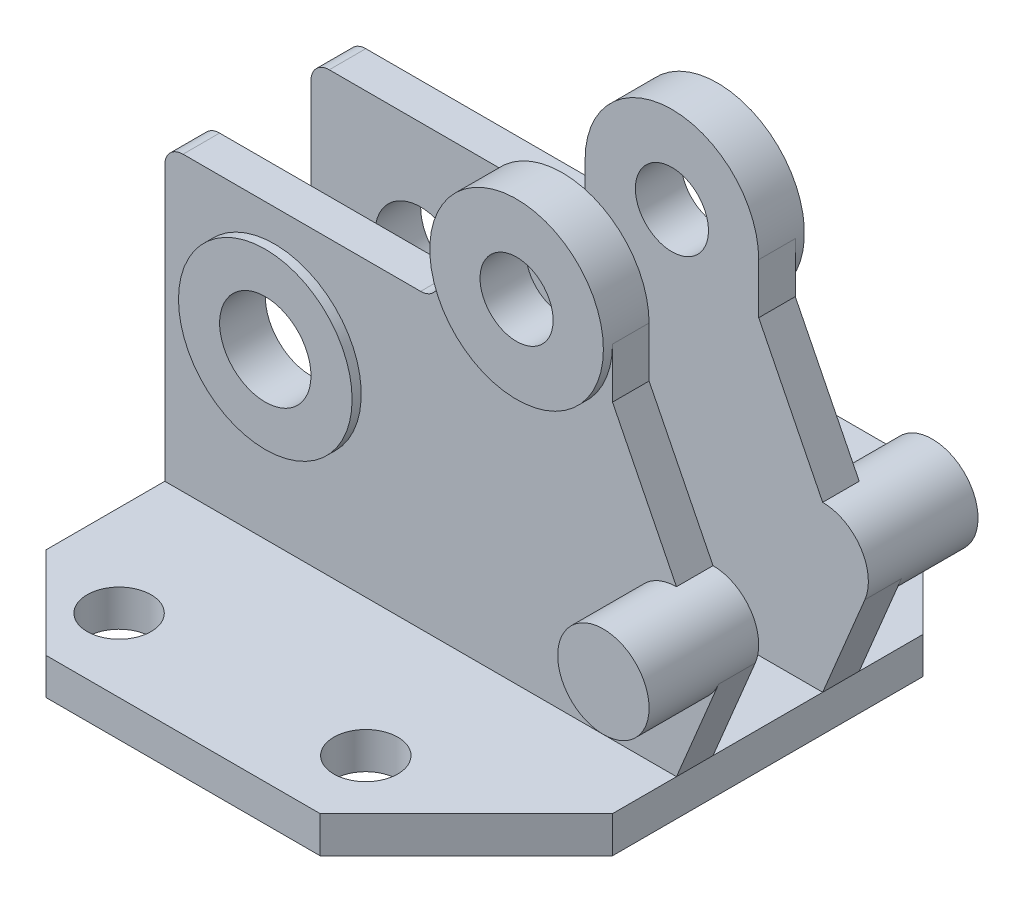
from build123d import *
from build123d.topology import SkipClean

# Parameters (mm, degrees)
SKETCH1_R               = 3.5
SKETCH1_W               = 56
SKETCH1_H               = 4
SKETCH1_H_2             = 12
BOSS_EXTRUDE1_DEPTH     = 4
SKETCH1_3_W             = 56
SKETCH1_3_H             = 4
BOSS_EXTRUDE2_DEPTH     = 36
SKETCH2_R               = 5
CUT_EXTRUDE1_DEPTH      = 36
BOSS_EXTRUDE3_START     = -20
BOSS_EXTRUDE3_OUTLINE_R = 9.5
BOSS_EXTRUDE3_DEPTH     = 20
CUT_EXTRUDE2_START      = -21
SKETCH2_4_R             = 4
CUT_EXTRUDE2_DEPTH      = 21
SKETCH4_W               = 61
SKETCH4_H               = 12
CUT_EXTRUDE3_DEPTH      = 47
BOSS_EXTRUDE4_START     = 1
SKETCH5_R               = 4
SKETCH5_R_2             = 9.5
SKETCH5_R_3             = 5
BOSS_EXTRUDE4_DEPTH     = 1
BOSS_EXTRUDE5_START     = 8
BOSS_EXTRUDE5_DEPTH     = 8
BOSS_EXTRUDE6_DEPTH     = 8
SKETCH2_6_R             = 9.5
SKETCH2_6_R_2           = 5
SKETCH2_6_R_3           = 4
BOSS_EXTRUDE7_DEPTH     = 1


# Read off the part's stored shape, not the designer's step: Boss-Extrude3
with BuildPart() as part:
    # Sketch1 → Boss-Extrude1 (new body)
    # profile 1 of 5: a face of its own
    with BuildSketch(Plane(origin=(0, 0, 0), x_dir=(1, 0, 0), z_dir=(0, 1, 0))):
        Polygon((56, 23), (0, 23), (0, 10), (10, 0), (40, 0), (56, 16), align=None)
        with Locations(Location((10, 8, 0), (0, 0, 270))):
            Circle(SKETCH1_R, mode=Mode.SUBTRACT)
        with Locations(Location((37, 8, 0), (0, 0, 270))):
            Circle(SKETCH1_R, mode=Mode.SUBTRACT)
    # profile 2 of 5: a face of its own
    with BuildSketch(Plane(origin=(0, 0, 0), x_dir=(1, 0, 0), z_dir=(0, 1, 0))):
        with Locations((28, 25)):
            Rectangle(SKETCH1_W, SKETCH1_H)
    # profile 3 of 5: a face of its own
    with BuildSketch(Plane(origin=(0, 0, 0), x_dir=(1, 0, 0), z_dir=(0, 1, 0))):
        with Locations((28, 33)):
            Rectangle(SKETCH1_W, SKETCH1_H_2)
    # profile 4 of 5: a face of its own
    with BuildSketch(Plane(origin=(0, 0, 0), x_dir=(1, 0, 0), z_dir=(0, 1, 0))):
        with Locations((28, 41)):
            Rectangle(SKETCH1_W, SKETCH1_H)
    # profile 5 of 5: a face of its own
    with BuildSketch(Plane(origin=(0, 0, 0), x_dir=(1, 0, 0), z_dir=(0, 1, 0))):
        Polygon((40, 66), (10, 66), (0, 56), (0, 43), (56, 43), (56, 50), align=None)
        with Locations(Location((12, 58, 0), (0, 0, 270))):
            Circle(SKETCH1_R, mode=Mode.SUBTRACT)
        with Locations(Location((39, 58, 0), (0, 0, 270))):
            Circle(SKETCH1_R, mode=Mode.SUBTRACT)
    extrude(amount=BOSS_EXTRUDE1_DEPTH)

    # Sketch1<3> → Boss-Extrude2 (add)
    with BuildSketch(Plane(origin=(0, 0, 0), x_dir=(1, 0, 0), z_dir=(0, 1, 0))):
        with Locations((28, 41)):
            Rectangle(SKETCH1_3_W, SKETCH1_3_H)
        with Locations((28, 25)):
            Rectangle(SKETCH1_3_W, SKETCH1_3_H)
    extrude(amount=BOSS_EXTRUDE2_DEPTH)

    # Sketch2 → Cut-Extrude1 (cut)
    with BuildSketch(Plane.XY.offset(-23)):
        with Locations((12, 23)):
            Circle(SKETCH2_R)
    extrude(amount=-CUT_EXTRUDE1_DEPTH, mode=Mode.SUBTRACT)

    # Boss-Extrude3 outline → Boss-Extrude3 (add)
    with BuildSketch(Plane.XY.offset(-23).offset(BOSS_EXTRUDE3_START)):
        with BuildLine():
            Line((28, 36), (2, 36))
            ThreePointArc((2, 36), (0.585786438, 35.414213562), (0, 34))
            Line((0, 34), (0, 4))
            Line((0, 4), (56, 4))
            Line((56, 4), (60.615384615, 15.076923077))
            ThreePointArc((60.615384615, 15.076923077), (60.160251472, 19.773500981), (56, 22))
            Line((56, 22), (49, 36))
            Line((49, 36), (49, 41.5))
            ThreePointArc((49, 41.5), (39.5, 51), (30, 41.5))
            Line((30, 41.5), (30, 38))
            ThreePointArc((30, 38), (29.414213562, 36.585786438), (28, 36))
        make_face()
        with Locations((12, 23)):
            Circle(BOSS_EXTRUDE3_OUTLINE_R, mode=Mode.SUBTRACT)
    extrude(amount=BOSS_EXTRUDE3_DEPTH)

    # Sketch2<4> → Cut-Extrude2 (cut)
    with SkipClean():  # the faces are left unmerged after this step: merging them gives an invalid solid
        with BuildSketch(Plane.XY.offset(-23).offset(CUT_EXTRUDE2_START)):
            with BuildLine():
                Line((30, 38), (30, 41.5))
                ThreePointArc((30, 41.5), (39.5, 51), (49, 41.5))
                Line((49, 41.5), (49, 36))
                Line((49, 36), (56, 36))
                Line((56, 36), (56, 22))
                ThreePointArc((56, 22), (59.535533906, 20.535533906), (61, 17))
                ThreePointArc((61, 17), (60.902903378, 16.019419324), (60.615384615, 15.076923077))
                Line((60.615384615, 15.076923077), (56, 4))
                Line((56, 4), (64.674649384, 4))
                Line((64.674649384, 4), (64.674649384, 61.803942061))
                Line((64.674649384, 61.803942061), (-6.186238706, 61.803942061))
                Line((-6.186238706, 61.803942061), (-6.186238706, 4))
                Line((-6.186238706, 4), (0, 4))
                Line((0, 4), (0, 34))
                Line((0, 34), (0, 36))
                Line((0, 36), (2, 36))
                Line((2, 36), (28, 36))
                ThreePointArc((28, 36), (29.414213562, 36.585786438), (30, 38))
            make_face()
            with BuildLine():
                ThreePointArc((0, 34), (0.585786438, 35.414213562), (2, 36))
                Line((2, 36), (0, 36))
                Line((0, 36), (0, 34))
            make_face()
            Polygon((56, 36), (49, 36), (56, 22), align=None)
            with Locations((39.5, 41.5)):
                Circle(SKETCH2_4_R)
        extrude(amount=CUT_EXTRUDE2_DEPTH, mode=Mode.SUBTRACT)
    add(part.part.scale(1), mode=Mode.REPLACE)  # the faces are merged on a copy

    # Sketch4 → Cut-Extrude3 (cut)
    with BuildSketch(Plane(origin=(0, 51, 0), x_dir=(1, 0, 0), z_dir=(0, 1, 0))):
        with Locations((30.5, 33)):
            Rectangle(SKETCH4_W, SKETCH4_H)
    extrude(amount=-CUT_EXTRUDE3_DEPTH, mode=Mode.SUBTRACT)

    # Sketch5 → Boss-Extrude4 (add)
    # profile 1 of 2: a face of its own
    with SkipClean():  # the faces are left unmerged after this step: merging them gives an invalid solid
        with BuildSketch(Plane(origin=(0, 0, -43), x_dir=(-1, 0, 0), z_dir=(0, 0, -1)).offset(BOSS_EXTRUDE4_START)):
            with BuildLine():
                ThreePointArc((-49, 41.5), (-39.5, 32), (-30, 41.5))
                ThreePointArc((-30, 41.5), (-39.5, 51), (-49, 41.5))
            make_face()
            with Locations((-39.5, 41.5)):
                Circle(SKETCH5_R, mode=Mode.SUBTRACT)
        # profile 2 of 2: a face of its own
        with BuildSketch(Plane(origin=(0, 0, -43), x_dir=(-1, 0, 0), z_dir=(0, 0, -1)).offset(BOSS_EXTRUDE4_START)):
            with Locations((-12, 23)):
                Circle(SKETCH5_R_2)
            with Locations(Location((-12, 23, 0), (0, 0, 180))):
                Circle(SKETCH5_R_3, mode=Mode.SUBTRACT)
        extrude(amount=-BOSS_EXTRUDE4_DEPTH)

    # Sketch5<3> → Boss-Extrude5 (add)
    with SkipClean():  # the faces are left unmerged after this step: merging them gives an invalid solid
        with BuildSketch(Plane(origin=(0, 0, -43), x_dir=(-1, 0, 0), z_dir=(0, 0, -1)).offset(BOSS_EXTRUDE5_START)):
            with BuildLine():
                ThreePointArc((-60.615384615, 15.076923077), (-55.019419324, 12.097096622), (-51, 17))
                ThreePointArc((-51, 17), (-52.464466094, 20.535533906), (-56, 22))
                ThreePointArc((-56, 22), (-60.160251472, 19.773500981), (-60.615384615, 15.076923077))
            make_face()
        extrude(amount=-BOSS_EXTRUDE5_DEPTH)

    # Sketch2<5> → Boss-Extrude6 (add)
    with SkipClean():  # the faces are left unmerged after this step: merging them gives an invalid solid
        with BuildSketch(Plane.XY.offset(-23)):
            with BuildLine():
                Line((56, 12), (56, 22))
                ThreePointArc((56, 22), (51, 17), (56, 12))
            make_face()
            with BuildLine():
                ThreePointArc((61, 17), (59.535533906, 20.535533906), (56, 22))
                Line((56, 22), (56, 12))
                ThreePointArc((56, 12), (58.773500981, 12.839748528), (60.615384615, 15.076923077))
                ThreePointArc((60.615384615, 15.076923077), (60.902903378, 16.019419324), (61, 17))
            make_face()
        extrude(amount=BOSS_EXTRUDE6_DEPTH)

    # Sketch2<6> → Boss-Extrude7 (add)
    # profile 1 of 3: a face of its own
    with BuildSketch(Plane.XY.offset(-23)):
        with Locations(Location((12, 23, 0), (0, 0, 180))):
            Circle(SKETCH2_6_R)
        with Locations((12, 23)):
            Circle(SKETCH2_6_R_2, mode=Mode.SUBTRACT)
    # profile 2 of 3: a face of its own
    with BuildSketch(Plane.XY.offset(-23)):
        with BuildLine():
            ThreePointArc((49, 41.5), (39.5, 51), (30, 41.5))
            ThreePointArc((30, 41.5), (30.449124805, 38.613538808), (31.754033308, 36))
            Line((31.754033308, 36), (47.245966692, 36))
            ThreePointArc((47.245966692, 36), (48.550875195, 38.613538808), (49, 41.5))
        make_face()
        with Locations(Location((39.5, 41.5, 0), (0, 0, 180))):
            Circle(SKETCH2_6_R_3, mode=Mode.SUBTRACT)
    # profile 3 of 3: a face of its own
    with BuildSketch(Plane.XY.offset(-23)):
        with BuildLine():
            Line((47.245966692, 36), (31.754033308, 36))
            ThreePointArc((31.754033308, 36), (39.5, 32), (47.245966692, 36))
        make_face()
    extrude(amount=BOSS_EXTRUDE7_DEPTH)


solid = part.part
